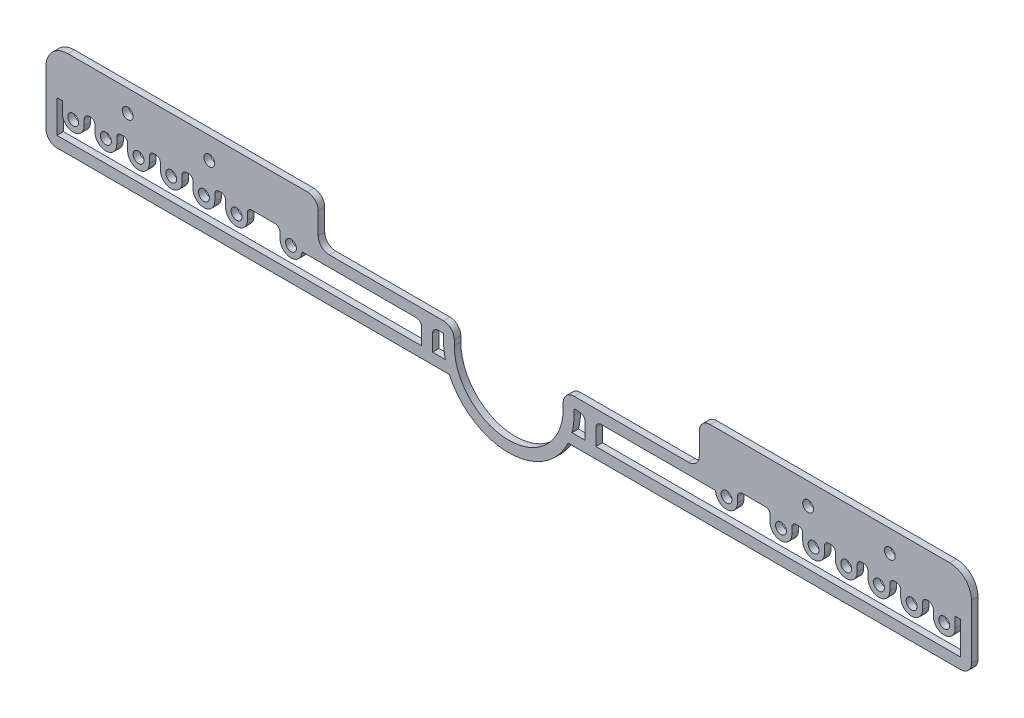
from build123d import *

# Parameters (mm, degrees)
SKETCH1_R           = 5
BOSS_EXTRUDE1_DEPTH = 6
SKETCH2_R           = 5
CUT_EXTRUDE1_DEPTH  = 436.529562716
SKETCH6_R           = 5
BOSS_EXTRUDE4_DEPTH = 6
BOSS_EXTRUDE5_DEPTH = 6
CUT_EXTRUDE2_DEPTH  = 436.529562716
FILLET1_R           = 10


with BuildPart() as part:
    # Sketch1 → Boss-Extrude1 (new body)
    with BuildSketch(Plane.XY):
        with BuildLine():
            Line((-425, -75), (-425, 35))
            ThreePointArc((-425, 35), (-419.142135624, 49.142135624), (-405, 55))
            Line((-405, 55), (-185.000330481, 55))
            ThreePointArc((-185.000330481, 55), (-177.92926267, 52.071067812), (-175.000330481, 45))
            Line((-175.000330481, 45), (-175.000330481, 25))
            ThreePointArc((-175.000330481, 25), (-172.071398293, 17.928932188), (-165.000330481, 15))
            Line((-165.000330481, 15), (-60, 15))
            ThreePointArc((-60, 15), (-52.928932188, 12.071067812), (-50, 5))
            Line((-50, 5), (-50, 0))
            ThreePointArc((-50, 0), (-35.355339059, -35.355339059), (0, -50))
            Line((0, -50), (0, -95))
            Line((0, -95), (-405, -95))
            ThreePointArc((-405, -95), (-419.142135624, -89.142135624), (-425, -75))
        make_face()
        with Locations((-350, 35)):
            Circle(SKETCH1_R, mode=Mode.SUBTRACT)
        with Locations((-275, 35)):
            Circle(SKETCH1_R, mode=Mode.SUBTRACT)
    boss_extrude1 = extrude(amount=BOSS_EXTRUDE1_DEPTH)

    # Mirror1: Boss-Extrude1 across plane
    add(boss_extrude1.mirror(Plane(origin=(0, -50, 6), x_dir=(0, 0, 1), z_dir=(-1, 0, 0))))

    # Sketch2 → Cut-Extrude1 (cut, through all)
    with BuildSketch(Plane.XY.offset(6)):
        with BuildLine():
            ThreePointArc((-390, 5), (-400, -5), (-410, 5))
            Line((-410, 5), (-410, 15))
            Line((-410, 15), (-415, 15))
            Line((-415, 15), (-415, -75))
            ThreePointArc((-415, -75), (-412.071067812, -82.071067812), (-405, -85))
            Line((-405, -85), (-85, -85))
            ThreePointArc((-85, -85), (-81.464466094, -83.535533906), (-80, -80))
            Line((-80, -80), (-80, 0))
            ThreePointArc((-80, 0), (-81.464466094, 3.535533906), (-85, 5))
            Line((-85, 5), (-190, 5))
            ThreePointArc((-190, 5), (-200, -5), (-210, 5))
            Line((-210, 5), (-210, 10))
            ThreePointArc((-210, 10), (-211.464466094, 13.535533906), (-215, 15))
            Line((-215, 15), (-385, 15))
            ThreePointArc((-385, 15), (-388.535533906, 13.535533906), (-390, 10))
            Line((-390, 10), (-390, 5))
        make_face()
        with BuildLine():
            ThreePointArc((-70, -80), (-68.535533906, -83.535533906), (-65, -85))
            Line((-65, -85), (0, -85))
            Line((0, -85), (0, -60))
            ThreePointArc((0, -60), (-42.426406871, -42.426406871), (-60, 0))
            Line((-60, 0), (-60, 5))
            Line((-60, 5), (-65, 5))
            ThreePointArc((-65, 5), (-68.535533906, 3.535533906), (-70, 0))
            Line((-70, 0), (-70, -80))
        make_face()
        with Locations((-400, 5)):
            Circle(SKETCH2_R)
        with Locations((-200, 5)):
            Circle(SKETCH2_R)
    cut_extrude1 = extrude(amount=-CUT_EXTRUDE1_DEPTH, mode=Mode.SUBTRACT)

    # Mirror2: Cut-Extrude1 across plane
    add(cut_extrude1.mirror(Plane(origin=(0, 0, 0), x_dir=(0, 0, 1), z_dir=(1, 0, 0))), mode=Mode.SUBTRACT)

    # Sketch6 → Boss-Extrude4 (add)
    # profile 1 of 5: a face of its own
    with BuildSketch(Plane.XY.offset(6)):
        with BuildLine():
            ThreePointArc((-384, 15), (-381.171572875, 13.828427125), (-380, 11))
            Line((-380, 11), (-380, 5))
            ThreePointArc((-380, 5), (-370, -5), (-360, 5))
            Line((-360, 5), (-360, 11))
            ThreePointArc((-360, 11), (-358.828427125, 13.828427125), (-356, 15))
            Line((-356, 15), (-384, 15))
        make_face()
        with Locations((-370, 5)):
            Circle(SKETCH6_R, mode=Mode.SUBTRACT)
    # profile 2 of 5: a face of its own
    with BuildSketch(Plane.XY.offset(6)):
        with BuildLine():
            ThreePointArc((-354, 15), (-351.171572875, 13.828427125), (-350, 11))
            Line((-350, 11), (-350, 5))
            ThreePointArc((-350, 5), (-340, -5), (-330, 5))
            Line((-330, 5), (-330, 11))
            ThreePointArc((-330, 11), (-328.828427125, 13.828427125), (-326, 15))
            Line((-326, 15), (-354, 15))
        make_face()
        with Locations((-340, 5)):
            Circle(SKETCH6_R, mode=Mode.SUBTRACT)
    # profile 3 of 5: a face of its own
    with BuildSketch(Plane.XY.offset(6)):
        with BuildLine():
            ThreePointArc((-324, 15), (-321.171572875, 13.828427125), (-320, 11))
            Line((-320, 11), (-320, 5))
            ThreePointArc((-320, 5), (-310, -5), (-300, 5))
            Line((-300, 5), (-300, 11))
            ThreePointArc((-300, 11), (-298.828427125, 13.828427125), (-296, 15))
            Line((-296, 15), (-324, 15))
        make_face()
        with Locations((-310, 5)):
            Circle(SKETCH6_R, mode=Mode.SUBTRACT)
    # profile 4 of 5: a face of its own
    with BuildSketch(Plane.XY.offset(6)):
        with BuildLine():
            ThreePointArc((-294, 15), (-291.171572875, 13.828427125), (-290, 11))
            Line((-290, 11), (-290, 5))
            ThreePointArc((-290, 5), (-280, -5), (-270, 5))
            Line((-270, 5), (-270, 11))
            ThreePointArc((-270, 11), (-268.828427125, 13.828427125), (-266, 15))
            Line((-266, 15), (-294, 15))
        make_face()
        with Locations((-280, 5)):
            Circle(SKETCH6_R, mode=Mode.SUBTRACT)
    # profile 5 of 5: a face of its own
    with BuildSketch(Plane.XY.offset(6)):
        with BuildLine():
            ThreePointArc((-264, 15), (-261.171572875, 13.828427125), (-260, 11))
            Line((-260, 11), (-260, 5))
            ThreePointArc((-260, 5), (-250, -5), (-240, 5))
            Line((-240, 5), (-240, 11))
            ThreePointArc((-240, 11), (-238.828427125, 13.828427125), (-236, 15))
            Line((-236, 15), (-264, 15))
        make_face()
        with Locations((-250, 5)):
            Circle(SKETCH6_R, mode=Mode.SUBTRACT)
    boss_extrude4 = extrude(amount=-BOSS_EXTRUDE4_DEPTH)

    # Mirror3: Boss-Extrude4 across plane
    add(boss_extrude4.mirror(Plane(origin=(0, 0, 0), x_dir=(0, 0, 1), z_dir=(1, 0, 0))))

    # Sketch5 → Boss-Extrude5 (add)
    with BuildSketch(Plane.XY.offset(6)):
        with BuildLine():
            Line((-425, -15), (-58.094750193, -15))
            ThreePointArc((-58.094750193, -15), (-56.540669107, -20.078663724), (-54.543560573, -25))
            Line((-54.543560573, -25), (-425, -25))
            Line((-425, -25), (-425, -15))
        make_face()
        with BuildLine():
            Line((425, -15), (425, -25))
            Line((425, -25), (43.301270189, -25))
            ThreePointArc((43.301270189, -25), (45.773021286, -20.120400652), (47.696960071, -15))
            Line((47.696960071, -15), (425, -15))
        make_face()
    extrude(amount=-BOSS_EXTRUDE5_DEPTH)

    # Sketch7 → Cut-Extrude2 (cut, through all)
    with BuildSketch(Plane.XY.offset(6)):
        with BuildLine():
            ThreePointArc((-54.543560573, -25), (0, -60), (54.543560573, -25))
            Line((54.543560573, -25), (425, -25))
            Line((425, -25), (425, -95))
            Line((425, -95), (-425, -95))
            Line((-425, -95), (-425, -25))
            Line((-425, -25), (-415, -25))
            Line((-415, -25), (-54.543560573, -25))
        make_face()
    extrude(amount=-CUT_EXTRUDE2_DEPTH, mode=Mode.SUBTRACT)

    # Fillet1
    fillet1_edges = [part.edges().sort_by_distance(p)[0] for p in [
        (-425, -25, 3),
        (425, -25, 3),
    ]]
    fillet(fillet1_edges, radius=FILLET1_R)


solid = part.part
